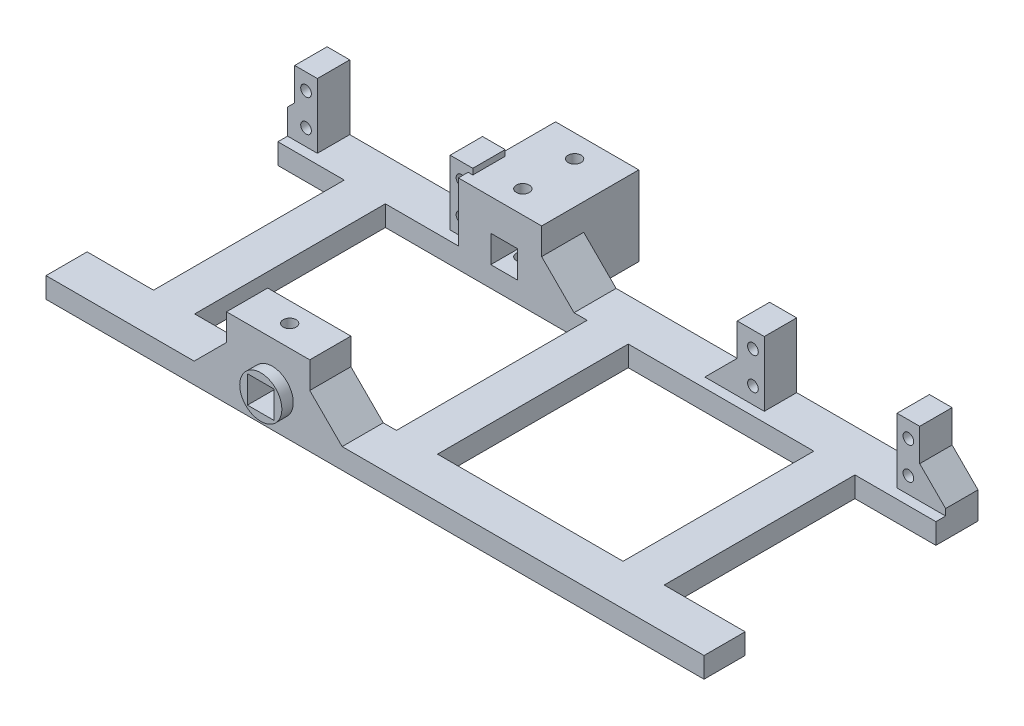
from build123d import *

# Parameters (mm, degrees)
SKETCH1_W           = 12.7
SKETCH1_H           = 58.9
BOSS_EXTRUDE1_DEPTH = 6.35
SKETCH6_W           = 16.7
SKETCH6_H           = 10
SKETCH6_W_2         = 7
SKETCH6_W_3         = 8.35
BOSS_EXTRUDE5_DEPTH = 20
FILLET6_SIZE        = 8
FILLET6_SIZE_2      = 20
SKETCH7_R           = 1.65
CUT_EXTRUDE1_DEPTH  = 219.058988591
BOSS_EXTRUDE6_DEPTH = 30
SKETCH10_W          = 25.7
SKETCH10_H          = 17.3
CUT_EXTRUDE2_DEPTH  = 229.063149203
SKETCH11_R          = 6.5
SKETCH11_W          = 8.2
SKETCH11_H          = 8.4
BOSS_EXTRUDE7_DEPTH = 2
SKETCH12_R          = 6.5
SKETCH12_W          = 8.2
SKETCH12_H          = 8.4
BOSS_EXTRUDE8_DEPTH = 1.525
SKETCH14_W          = 8.05
SKETCH14_H          = 18
SKETCH14_W_2        = 8.35
SKETCH14_H_2        = 10
CUT_EXTRUDE4_DEPTH  = 230.655188552
CUT_EXTRUDE5_DEPTH  = 230.655188544
SKETCH17_R          = 2
CUT_EXTRUDE6_DEPTH  = 231.096084549
CHAMFER1_SIZE       = 10


with BuildPart() as part:
    # Sketch1 → Boss-Extrude1 (new body)
    with BuildSketch(Plane(origin=(0, 0, 0), x_dir=(1, 0, 0), z_dir=(0, 1, 0))):
        Polygon((0, 101.6), (0, 71.6), (20.5, 71.6), (33.2, 71.6), (95.5, 71.6), (108.2, 71.6), (165.5, 71.6), (178.2, 71.6), (203.2, 71.6), (203.2, 101.6), align=None)
        with Locations((26.85, 42.15)):
            Rectangle(SKETCH1_W, SKETCH1_H)
        with Locations((101.85, 42.15)):
            Rectangle(SKETCH1_W, SKETCH1_H)
        with Locations((171.85, 42.15)):
            Rectangle(SKETCH1_W, SKETCH1_H)
        Polygon((20.5, 12.7), (0, 12.7), (0, 0), (203.2, 0), (203.2, 12.7), (178.2, 12.7), (165.5, 12.7), (108.2, 12.7), (95.5, 12.7), (33.2, 12.7), align=None)
    extrude(amount=BOSS_EXTRUDE1_DEPTH)

    # Sketch6 → Boss-Extrude5 (add)
    with BuildSketch(Plane(origin=(0, 6.35, 0), x_dir=(1, 0, 0), z_dir=(0, 1, 0))):
        with Locations((138.85, 79.6)):
            Rectangle(SKETCH6_W, SKETCH6_H)
        with Locations((191.7, 79.6)):
            Rectangle(SKETCH6_W_2, SKETCH6_H)
        with Locations((134.675, 79.6)):
            Rectangle(SKETCH6_W_3, SKETCH6_H)
        with Locations((86, 79.6)):
            Rectangle(SKETCH6_W_2, SKETCH6_H)
        with Locations((53.7, 79.6)):
            Rectangle(SKETCH6_W_2, SKETCH6_H)
        with Locations((5.7, 79.6)):
            Rectangle(SKETCH6_W_2, SKETCH6_H)
    extrude(amount=BOSS_EXTRUDE5_DEPTH)

    # Fillet6
    # an asymmetric fillet: 20, 8 mm, written as the material it adds along each edge
    with BuildSketch(Plane(origin=(82.5, 6.35, -84.6), x_dir=(-1, 0, 0), z_dir=(0, 0, 1))) as fillet6_piece_1:
        with BuildLine():
            Bezier((FILLET6_SIZE, 0), (0, 0), (0, -FILLET6_SIZE_2), weights=[1, 0.707106781, 1])
            Line((0, -FILLET6_SIZE_2), (-0.4, -20))
            Line((-0.4, -20), (-0.4, 0.4))
            Line((-0.4, 0.4), (8, 0.4))
            Line((8, 0.4), (FILLET6_SIZE, 0))
        make_face()
    extrude(amount=10)
    with BuildSketch(Plane(origin=(89.5, 6.35, -84.6), x_dir=(0, 0, -1), z_dir=(-1, 0, 0))) as fillet6_piece_2:
        with BuildLine():
            Bezier((FILLET6_SIZE, 0), (0, 0), (0, -FILLET6_SIZE_2), weights=[1, 0.707106781, 1])
            Line((0, -FILLET6_SIZE_2), (-0.4, -20))
            Line((-0.4, -20), (-0.4, 0.4))
            Line((-0.4, 0.4), (8, 0.4))
            Line((8, 0.4), (FILLET6_SIZE, 0))
        make_face()
    extrude(amount=7)
    with BuildSketch(Plane(origin=(89.5, 6.35, -84.6), x_dir=(0, 0, -1), z_dir=(-1, 0, 0))) as fillet6_piece_3a_section:
        with BuildLine():
            Bezier((FILLET6_SIZE, 0), (0, 0), (0, -FILLET6_SIZE_2), weights=[1, 0.707106781, 1])
            Line((0, -FILLET6_SIZE_2), (-0.4, -20))
            Line((-0.4, -20), (-0.4, 0.4))
            Line((-0.4, 0.4), (8, 0.4))
            Line((8, 0.4), (FILLET6_SIZE, 0))
        make_face()
    fillet6_piece_3a = extrude(amount=57, mode=Mode.PRIVATE)
    fillet6_piece_3a = split(fillet6_piece_3a, bisect_by=Plane(origin=(82.5, 11.442766382, -86.187108648), z_dir=(-1, 0, 0)), keep=Keep.TOP, mode=Mode.PRIVATE)
    with BuildSketch(Plane(origin=(82.5, 6.35, -134.6), x_dir=(-1, 0, 0), z_dir=(0, 0, 1))) as fillet6_piece_3b_section:
        with BuildLine():
            Bezier((FILLET6_SIZE, 0), (0, 0), (0, -FILLET6_SIZE_2), weights=[1, 0.707106781, 1])
            Line((0, -FILLET6_SIZE_2), (-0.4, -20))
            Line((-0.4, -20), (-0.4, 0.4))
            Line((-0.4, 0.4), (8, 0.4))
            Line((8, 0.4), (FILLET6_SIZE, 0))
        make_face()
    fillet6_piece_3b = extrude(amount=60, mode=Mode.PRIVATE)
    fillet6_piece_3b = split(fillet6_piece_3b, bisect_by=Plane(origin=(80.912890407, 11.442765861, -84.6), z_dir=(0, 0, -1)), keep=Keep.TOP, mode=Mode.PRIVATE)
    fillet6_piece_3 = fillet6_piece_3a & fillet6_piece_3b
    add(fillet6_piece_3)

    # Sketch7 → Cut-Extrude1 (cut, through all)
    with BuildSketch(Plane.XY.offset(-74.6)):
        with Locations((191.7, 21.3)):
            Circle(SKETCH7_R)
        with Locations((191.7, 11.4)):
            Circle(SKETCH7_R)
        with Locations((143.7, 11.4)):
            Circle(SKETCH7_R)
        with Locations((143.7, 21.3)):
            Circle(SKETCH7_R)
        with Locations((86, 21.3)):
            Circle(SKETCH7_R)
        with Locations((86, 11.4)):
            Circle(SKETCH7_R)
        with Locations((134, 21.3)):
            Circle(SKETCH7_R)
        with Locations((134, 11.4)):
            Circle(SKETCH7_R)
        with Locations((5.7, 21.3)):
            Circle(SKETCH7_R)
        with Locations((5.7, 11.4)):
            Circle(SKETCH7_R)
        with Locations((53.7, 11.4)):
            Circle(SKETCH7_R)
        with Locations((53.7, 21.3)):
            Circle(SKETCH7_R)
    extrude(amount=-CUT_EXTRUDE1_DEPTH, mode=Mode.SUBTRACT)

    # Sketch9 → Boss-Extrude6 (add)
    with BuildSketch(Plane(origin=(0, 0, -101.6), x_dir=(-1, 0, 0), z_dir=(0, 0, -1))):
        Polygon((-73.95, 6.35), (-73.95, 14.75), (-65.75, 14.75), (-65.75, 6.35), (-55.75, 6.35), (-55.75, 24.55), (-81.45, 24.55), (-81.45, 6.35), align=None)
    boss_extrude6 = extrude(amount=-BOSS_EXTRUDE6_DEPTH)

    # Mirror1: Boss-Extrude6 across plane
    add(boss_extrude6.mirror(Plane(origin=(0, 0, -50.8), x_dir=(1, 0, 0), z_dir=(0, 0, -1))))

    # Sketch10 → Cut-Extrude2 (cut, through all)
    with BuildSketch(Plane(origin=(0, 6.35, 0), x_dir=(-1, 0, 0), z_dir=(0, -1, 0))):
        with Locations((-68.6, 21.35)):
            Rectangle(SKETCH10_W, SKETCH10_H)
    extrude(amount=-CUT_EXTRUDE2_DEPTH, mode=Mode.SUBTRACT)

    # Sketch11 → Boss-Extrude7 (add)
    with BuildSketch(Plane(origin=(0, 0, -101.6), x_dir=(-1, 0, 0), z_dir=(0, 0, -1))):
        with Locations((-69.85, 10.55)):
            Circle(SKETCH11_R)
        with Locations((-69.85, 10.55)):
            Rectangle(SKETCH11_W, SKETCH11_H, mode=Mode.SUBTRACT)
    boss_extrude7 = extrude(amount=BOSS_EXTRUDE7_DEPTH)

    # Sketch12 → Boss-Extrude8 (add)
    with BuildSketch(Plane(origin=(0, 0, -103.6), x_dir=(-1, 0, 0), z_dir=(0, 0, -1))):
        with Locations((-69.85, 10.55)):
            Circle(SKETCH12_R)
        with Locations((-69.85, 10.55)):
            Rectangle(SKETCH12_W, SKETCH12_H, mode=Mode.SUBTRACT)
    boss_extrude8 = extrude(amount=BOSS_EXTRUDE8_DEPTH)

    # Mirror2: Boss-Extrude7, Boss-Extrude8 across plane
    add(boss_extrude7.mirror(Plane(origin=(0, 0, -50.8), x_dir=(1, 0, 0), z_dir=(0, 0, -1))))
    add(boss_extrude8.mirror(Plane(origin=(0, 0, -50.8), x_dir=(1, 0, 0), z_dir=(0, 0, -1))))

    # Sketch14 → Cut-Extrude4 (cut, through all)
    with BuildSketch(Plane(origin=(0, 6.35, 0), x_dir=(1, 0, 0), z_dir=(0, 1, 0))):
        with Locations((85.475, 83.6)):
            Rectangle(SKETCH14_W, SKETCH14_H)
        with Locations((134.675, 79.6)):
            Rectangle(SKETCH14_W_2, SKETCH14_H_2)
    extrude(amount=CUT_EXTRUDE4_DEPTH, mode=Mode.SUBTRACT)

    # Sketch15 → Cut-Extrude5 (cut, through all)
    with BuildSketch(Plane(origin=(0, 6.35, 0), x_dir=(1, 0, 0), z_dir=(0, 1, 0))):
        Polygon((188.2, 84.6), (195.2, 84.6), (203.2, 84.6), (203.2, 101.6), (81.45, 101.6), (81.45, 84.6), (138.85, 84.6), (147.2, 84.6), align=None)
        Polygon((0, 101.6), (0, 84.6), (57.2, 84.6), (55.75, 84.6), (55.75, 101.6), align=None)
    extrude(amount=-CUT_EXTRUDE5_DEPTH, mode=Mode.SUBTRACT)

    # Sketch17 → Cut-Extrude6 (cut, through all)
    with BuildSketch(Plane(origin=(0, 24.55, 0), x_dir=(1, 0, 0), z_dir=(0, 1, 0))):
        with Locations(Location((68.6, 6.6355, 0), (0, 0, 270))):
            Circle(SKETCH17_R)
        with Locations(Location((68.6, 78.6355, 0), (0, 0, 270))):
            Circle(SKETCH17_R)
        with Locations(Location((68.6, 94.6355, 0), (0, 0, 270))):
            Circle(SKETCH17_R)
    extrude(amount=-CUT_EXTRUDE6_DEPTH, mode=Mode.SUBTRACT)

    # Chamfer1
    # the kernel refuses this chamfer: 10 mm, written as the material it adds along each edge
    with BuildSketch(Plane(origin=(2.2, 6.35, -84.6), x_dir=(-0.9996219169112968, -0.027495876610586386, 0), z_dir=(0, 0, 1))) as chamfer1_piece_1_section:
        Polygon((CHAMFER1_SIZE * 0.999621916911, -CHAMFER1_SIZE * 0.0274958766106), (-CHAMFER1_SIZE * 0.0274958766106, -CHAMFER1_SIZE * 0.999621916911), (0, 0), align=None)
    chamfer1_piece_1 = extrude(amount=10, mode=Mode.PRIVATE)
    chamfer1_piece_1 = split(chamfer1_piece_1, bisect_by=Plane(origin=(0, 10.91513357, -79.6), z_dir=(1, 0, 0)), keep=Keep.TOP, mode=Mode.PRIVATE)
    add(chamfer1_piece_1)
    with BuildSketch(Plane(origin=(81.45, 6.35, -71.6), x_dir=(-0.027495876610586313, 0.9996219169112968, 0), z_dir=(0, 0, -1))) as chamfer1_piece_2:
        Polygon((CHAMFER1_SIZE * 0.999621916911, CHAMFER1_SIZE * 0.0274958766106), (-CHAMFER1_SIZE * 0.0274958766106, CHAMFER1_SIZE * 0.999621916911), (0, 0), align=None)
    extrude(amount=13)
    with BuildSketch(Plane(origin=(81.45, 6.35, 0), x_dir=(0.9996219169112968, -0.027495876610586403, 0), z_dir=(0, 0, -1))) as chamfer1_piece_3:
        Polygon((CHAMFER1_SIZE * 0.999621916911, -CHAMFER1_SIZE * 0.0274958766106), (-CHAMFER1_SIZE * 0.0274958766106, -CHAMFER1_SIZE * 0.999621916911), (0, 0), align=None)
    extrude(amount=12.7)
    with BuildSketch(Plane(origin=(55.75, 6.35, 0), x_dir=(-0.9996219169112968, -0.027495876610586403, 0), z_dir=(0, 0, -1))) as chamfer1_piece_4:
        Polygon((CHAMFER1_SIZE * 0.999621916911, CHAMFER1_SIZE * 0.0274958766106), (-CHAMFER1_SIZE * 0.0274958766106, CHAMFER1_SIZE * 0.999621916911), (0, 0), align=None)
    extrude(amount=12.7)
    with BuildSketch(Plane(origin=(138.85, 6.35, -74.6), x_dir=(-0.9996219169112968, -0.027495876610586365, 0), z_dir=(0, 0, -1))) as chamfer1_piece_5:
        Polygon((CHAMFER1_SIZE * 0.999621916911, CHAMFER1_SIZE * 0.0274958766106), (-CHAMFER1_SIZE * 0.0274958766106, CHAMFER1_SIZE * 0.999621916911), (0, 0), align=None)
    extrude(amount=10)
    with BuildSketch(Plane(origin=(195.2, 6.35, -74.6), x_dir=(0.9996219169112968, -0.027495876610586365, 0), z_dir=(0, 0, -1))) as chamfer1_piece_6_section:
        Polygon((CHAMFER1_SIZE * 0.999621916911, -CHAMFER1_SIZE * 0.0274958766106), (-CHAMFER1_SIZE * 0.0274958766106, -CHAMFER1_SIZE * 0.999621916911), (0, 0), align=None)
    chamfer1_piece_6 = extrude(amount=10, mode=Mode.PRIVATE)
    chamfer1_piece_6 = split(chamfer1_piece_6, bisect_by=Plane(origin=(203.2, 9.807184123, -79.6), z_dir=(-1, 0, 0)), keep=Keep.TOP, mode=Mode.PRIVATE)
    add(chamfer1_piece_6)


solid = part.part
